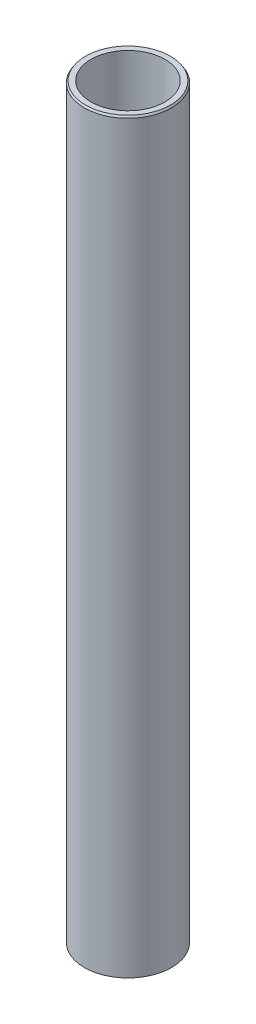
from build123d import *
from OCP.BRepFilletAPI import BRepFilletAPI_MakeChamfer

# Parameters (mm, degrees)
SKETCH1_R           = 35
BOSS_EXTRUDE1_DEPTH = 600
SKETCH2_R           = 29.684989002
CUT_EXTRUDE1_DEPTH  = 603.038204768
CHAMFER1_SIZE       = 1.433973981
CHAMFER1_SIZE2      = 0.969616982


with BuildPart() as part:
    # Sketch1 → Boss-Extrude1 (new body)
    with BuildSketch(Plane(origin=(0, 0, 0), x_dir=(1, 0, 0), z_dir=(0, 1, 0))):
        Circle(SKETCH1_R)
    extrude(amount=BOSS_EXTRUDE1_DEPTH)

    # Sketch2 → Cut-Extrude1 (cut, through all)
    with BuildSketch(Plane(origin=(0, 0, 0), x_dir=(1, 0, 0), z_dir=(0, 1, 0))):
        Circle(SKETCH2_R)
    extrude(amount=CUT_EXTRUDE1_DEPTH, mode=Mode.SUBTRACT)

    # Chamfer1: one chamfer whose edges measure the first distance from different faces: ONE call of the kernel's chamfer builder (chamfer() names one face for all edges)
    chamfer1_edges_1 = [part.edges().sort_by_distance(p)[0] for p in [
        (-35, 600, 0),
    ]]
    chamfer1_side_1 = [part.faces().sort_by_distance(p)[0] for p in [
        (-35, 300, 0),
    ]]
    chamfer1_edges_2 = [part.edges().sort_by_distance(p)[0] for p in [
        (-35, 0, 0),
    ]]
    chamfer1_side_2 = [part.faces().sort_by_distance(p)[0] for p in [
        (-34.010050506, 0, 0),
    ]]
    chamfer1 = BRepFilletAPI_MakeChamfer(part.part.solid().wrapped)
    for e in chamfer1_edges_1:
        chamfer1.Add(CHAMFER1_SIZE, CHAMFER1_SIZE2, e.wrapped, chamfer1_side_1[0].wrapped)  # the first distance lies on this face
    for e in chamfer1_edges_2:
        chamfer1.Add(CHAMFER1_SIZE, CHAMFER1_SIZE2, e.wrapped, chamfer1_side_2[0].wrapped)  # the first distance lies on this face
    add(Compound.cast(chamfer1.Shape()), mode=Mode.REPLACE)


solid = part.part
